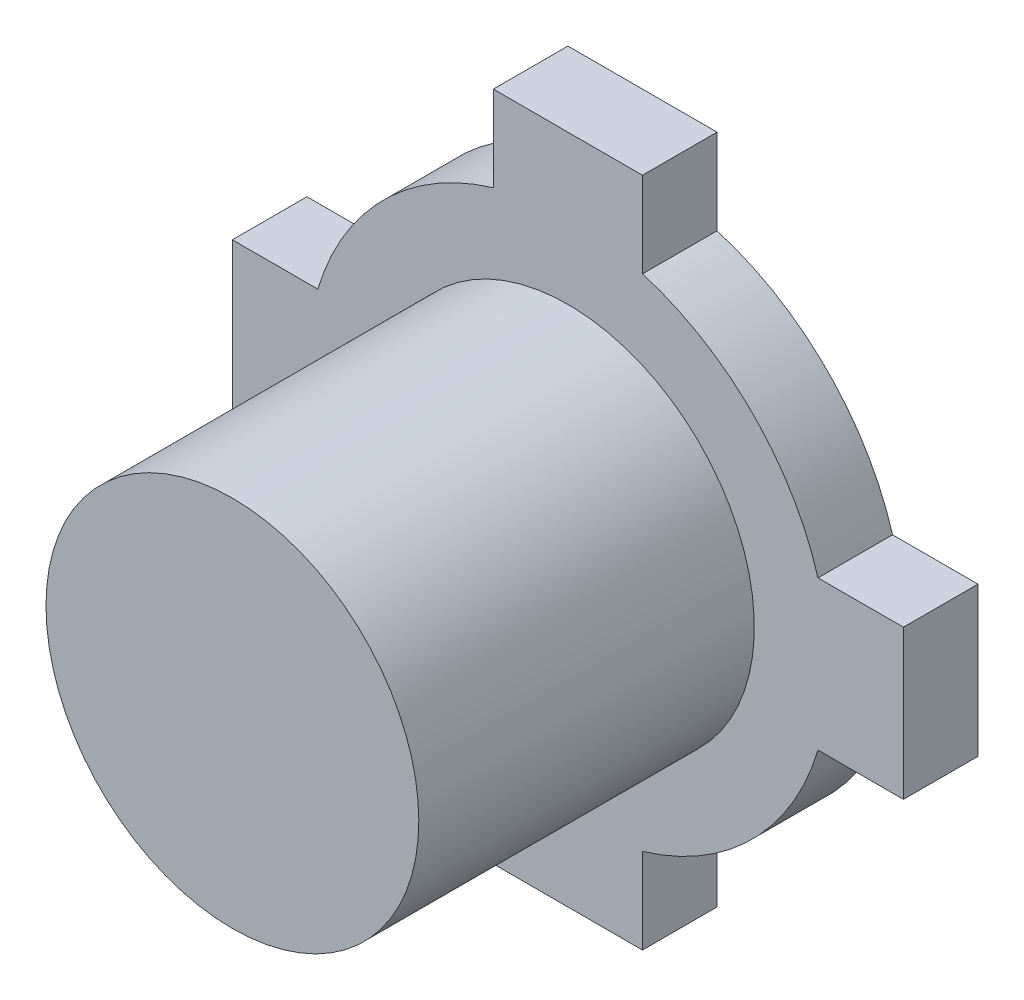
from build123d import *

# Parameters (mm, degrees)
SKETCH1_R           = 2.5
BOSS_EXTRUDE1_DEPTH = 4.5
BOSS_EXTRUDE2_DEPTH = 1


with BuildPart() as part:
    # Sketch1 → Boss-Extrude1 (new body)
    with BuildSketch(Plane.XY):
        Circle(SKETCH1_R)
    extrude(amount=BOSS_EXTRUDE1_DEPTH)

    # Sketch2 → Boss-Extrude2 (add)
    with BuildSketch(Plane(origin=(0, 0, 0), x_dir=(-1, 0, 0), z_dir=(0, 0, -1))):
        with BuildLine():
            Line((-3.354101966, 1), (-4.5, 1))
            Line((-4.5, 1), (-4.5, -1))
            Line((-4.5, -1), (-3.354101966, -1))
            ThreePointArc((-3.354101966, -1), (-2.474873734, -2.474873734), (-1, -3.354101966))
            Line((-1, -3.354101966), (-1, -4.5))
            Line((-1, -4.5), (1, -4.5))
            Line((1, -4.5), (1, -3.354101966))
            ThreePointArc((1, -3.354101966), (2.474873734, -2.474873734), (3.354101966, -1))
            Line((3.354101966, -1), (4.5, -1))
            Line((4.5, -1), (4.5, 1))
            Line((4.5, 1), (3.354101966, 1))
            ThreePointArc((3.354101966, 1), (2.474873734, 2.474873734), (1, 3.354101966))
            Line((1, 3.354101966), (1, 4.5))
            Line((1, 4.5), (-1, 4.5))
            Line((-1, 4.5), (-1, 3.354101966))
            ThreePointArc((-1, 3.354101966), (-2.474873734, 2.474873734), (-3.354101966, 1))
        make_face()
    extrude(amount=BOSS_EXTRUDE2_DEPTH)


solid = part.part
